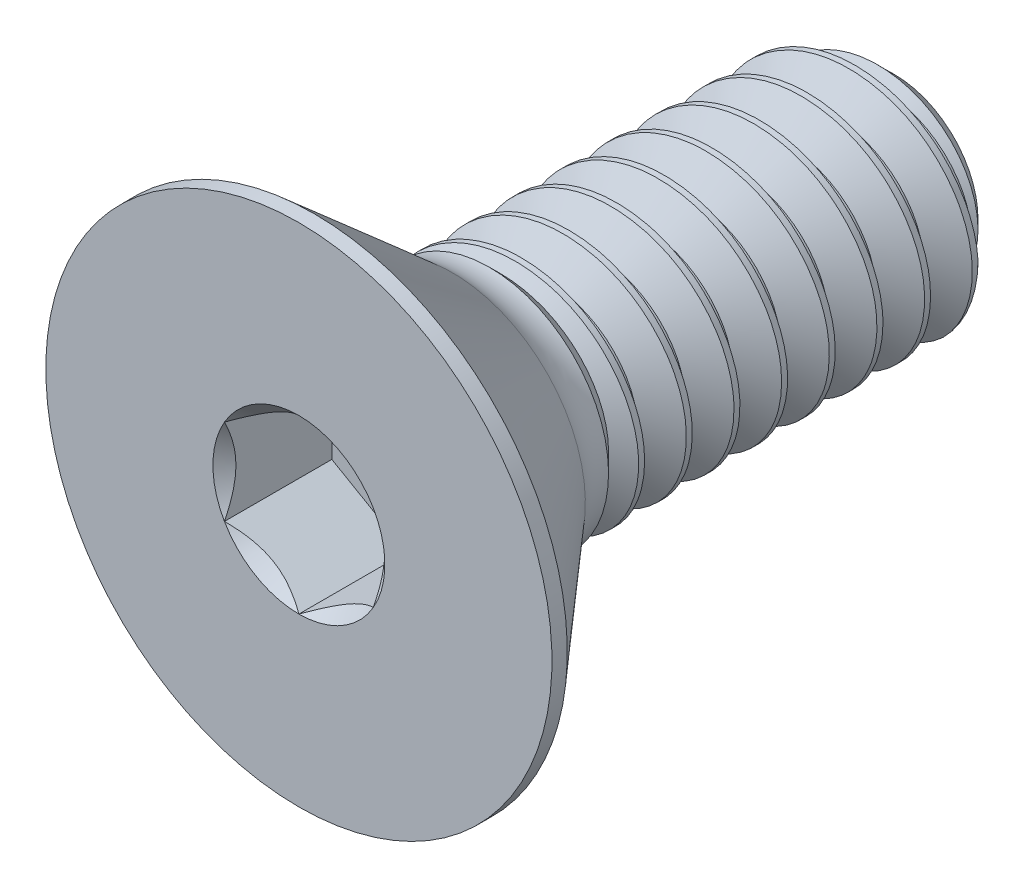
from build123d import *

# Parameters (mm, degrees)
SKETCH1_W          = 15.875
SKETCH1_H          = 3.175
CHAMFER1_SIZE      = 0.9525
CUT_SWEEP1_PITCH   = 1.27
CUT_EXTRUDE2_DEPTH = 2.86258


with BuildPart() as part:
    # Sketch1 → Revolve1 (revolve)
    with BuildSketch(Plane(origin=(0, 0, 0), x_dir=(0, 0, -1), z_dir=(1, 0, 0))):
        with Locations((7.9375, 1.5875)):
            Rectangle(SKETCH1_W, SKETCH1_H)
    revolve(axis=Axis((0, 0, -15.875), (0, 0, 1)))

    # Chamfer1
    chamfer1_edges = [part.edges().sort_by_distance(p)[0] for p in [
        (0, -3.175, -15.875),
    ]]
    chamfer(chamfer1_edges, length=CHAMFER1_SIZE)

    # Cut-Sweep1: arcs per turn and ends read off the stored shape
    # Cut-Sweep1: the profile of Sketch2 profile screwed along a right-hand helix through 14 turns, 8 arcs to a turn; built about Z, then put on its axis
    cut_sweep1_z = Axis((0, 0, 0), (0, 0, 1))
    cut_sweep1_corners = [(3.1753, 0, 0.000173205), (3.1753, 0, -1.111423205), (2.350110803, 0, -0.635), (2.350110803, 0, -0.47625)]
    with BuildLine(mode=Mode.PRIVATE) as cut_sweep1_profile:
        Line(cut_sweep1_corners[0], cut_sweep1_corners[1])
        Line(cut_sweep1_corners[1], cut_sweep1_corners[2])
        Line(cut_sweep1_corners[2], cut_sweep1_corners[3])
        Line(cut_sweep1_corners[3], cut_sweep1_corners[0])
    cut_sweep1_cap = Face(cut_sweep1_profile.wire())
    cut_sweep1_turn_angles = [0, 22.5, 45, 67.5, 90, 112.5, 135, 157.5, 180, 202.5, 225, 247.5, 270, 292.5, 315, 337.5, 360]
    cut_sweep1_turn_weights = [1, 0.9238795325112867, 1, 0.9238795325112867, 1, 0.9238795325112867, 1, 0.9238795325112867, 1, 0.9238795325112867, 1, 0.9238795325112867, 1, 0.9238795325112867, 1, 0.9238795325112867, 1]
    cut_sweep1_turn_rails = [Edge.make_bspline([Vector(p[0], p[1], 0).rotate(cut_sweep1_z, cut_sweep1_turn_angles[k]) / cut_sweep1_turn_weights[k] + Vector(0, 0, p[2] + CUT_SWEEP1_PITCH * cut_sweep1_turn_angles[k] / 360) for k in range(17)], [0, 0, 0, 1, 1, 2, 2, 3, 3, 4, 4, 5, 5, 6, 6, 7, 7, 8, 8, 8], 2, cut_sweep1_turn_weights) for p in cut_sweep1_corners]
    cut_sweep1_turn_sides = [Face.make_surface_from_curves(cut_sweep1_turn_rails[p[0]], cut_sweep1_turn_rails[p[1]]) for p in [(0, 1), (1, 2), (2, 3), (3, 0)]]
    cut_sweep1_turn = Solid(Shell([*cut_sweep1_turn_sides, cut_sweep1_cap, cut_sweep1_cap.rotate(cut_sweep1_z, 360).moved(Location((0, 0, CUT_SWEEP1_PITCH * 360 / 360)))]))
    cut_sweep1_each = [*[cut_sweep1_turn.moved(Location((0, 0, CUT_SWEEP1_PITCH * i))) for i in range(14)]]
    add(Plane(origin=(0, 0, -15.875), x_dir=(0, 1, 0), z_dir=(0, 0, 1)) * Compound([cut_sweep1_each[i] for i in range(0, 14, 2)]), mode=Mode.SUBTRACT)
    add(Plane(origin=(0, 0, -15.875), x_dir=(0, 1, 0), z_dir=(0, 0, 1)) * Compound([cut_sweep1_each[i] for i in range(1, 14, 2)]), mode=Mode.SUBTRACT)


with BuildPart() as body_2:
    # Sketch7 → Revolve2 (revolve)
    with BuildSketch(Plane(origin=(0, 0, 0), x_dir=(0, 0, -1), z_dir=(1, 0, 0)), mode=Mode.PRIVATE) as revolve2_sk:
        with BuildLine():
            Line((0, 6.7437), (0.40894, 6.7437))
            Line((0.40894, 6.7437), (4.0894, 3.544324933))
            ThreePointArc((4.0894, 3.544324933), (4.549909788, 3.270350399), (5.077204404, 3.175))
            Line((5.077204404, 3.175), (5.077204404, 0))
            Line((5.077204404, 0), (0, 0))
            Line((0, 0), (0, 6.7437))
        make_face()
    revolve(revolve2_sk.sketch.rotate(Axis((0, 0, 0), (0, 0, -1)), 180), axis=Axis((0, 0, 0), (0, 0, -1)))

    # Boss-Extrude1 cone 1 section (through the dimple's axis) → Boss-Extrude1 (revolve)
    with BuildSketch(Plane(origin=(0, 0, -5.077204404), x_dir=(0, -1, 0), z_dir=(1, 0, 0))):
        Polygon((0, 0), (3.175, 0), (0, 3.175), align=None)
    revolve(axis=Axis((0, 0, -5.077204404), (0, 0, -1)))

    # Combine1: union part
    add(part.part)

    # Sketch5 → Cut-Extrude2 (cut)
    with BuildSketch(Plane.XY):
        Polygon((1.984375, -1.14567944), (1.984375, 1.14567944), (0, 2.291358881), (-1.984375, 1.14567944), (-1.984375, -1.14567944), (0, -2.291358881), align=None)
    extrude(amount=-CUT_EXTRUDE2_DEPTH, mode=Mode.SUBTRACT)

    # Cut-Extrude3 cone 1 section (through the dimple's axis) → Cut-Extrude3 (revolve, cut)
    with BuildSketch(Plane(origin=(0, 0, 0), x_dir=(0, -1, 0), z_dir=(1, 0, 0))):
        Polygon((0, 0), (2.291358881, 0), (0, 2.291358881), align=None)
    revolve(axis=Axis((0, 0, 0), (0, 0, -1)), mode=Mode.SUBTRACT)


solid = body_2.part
